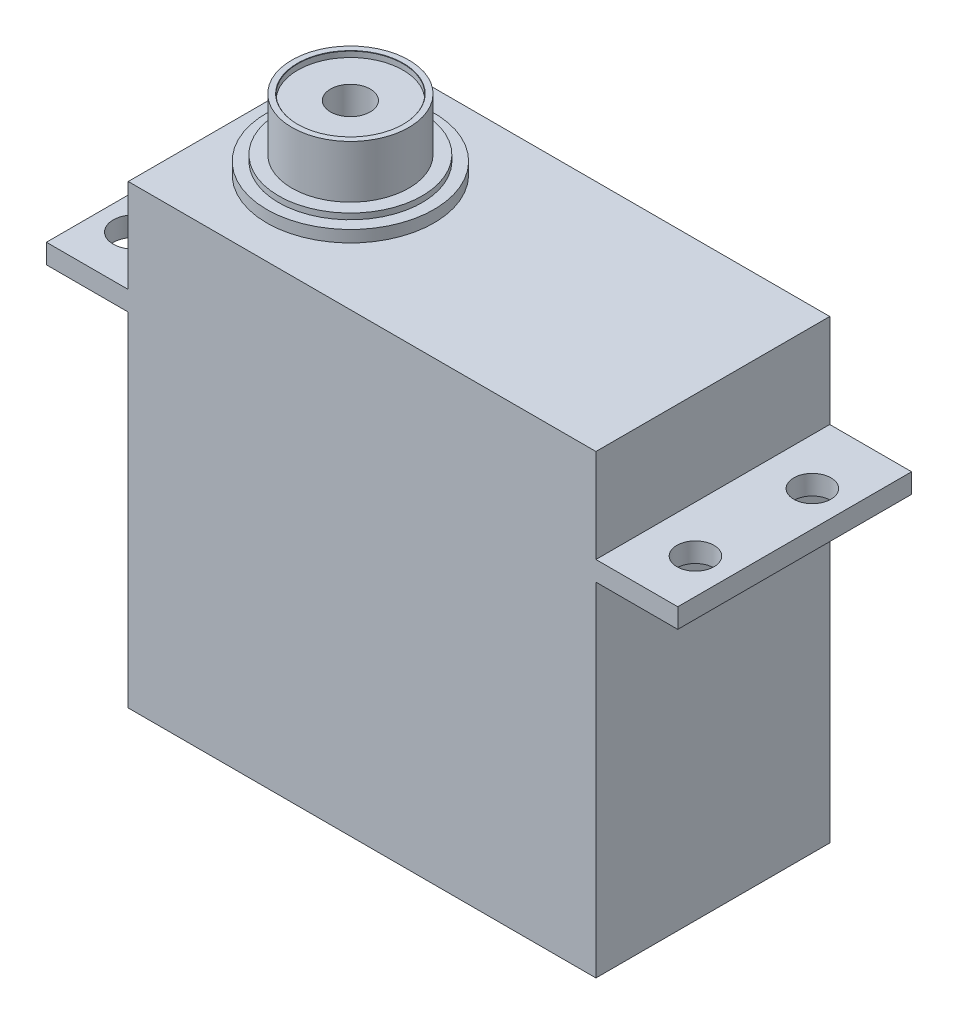
from build123d import *

# Parameters (mm, degrees)
SKETCH_2_W               = 40
SKETCH_2_H               = 20
EXTRUDE_2_DEPTH          = 39
SKETCH_3_W               = 20
SKETCH_3_H               = 1.675329881
EXTRUDE_3_DEPTH          = 7
SKETCH_14_W              = 20
SKETCH_14_H              = 1.675329881
EXTRUDE_4_DEPTH          = 7
CUT_EXTRUDE_3_DEPTH      = 43.308391603
CUT_EXTRUDE_3_DEPTH_BACK = 43.308391603
SKETCH_4_R               = 1.588943236
SKETCH_4_R_2             = 1.799105319
CUT_EXTRUDE_4_DEPTH      = 43.308391603
CUT_EXTRUDE_4_DEPTH_BACK = 43.308391603
SKETCH_15_R              = 1.59
SKETCH_21_R              = 5
EXTRUDE_6_DEPTH          = 6
SKETCH_39_R              = 7.15181499
SKETCH_39_R_2            = 6.138003982
EXTRUDE_9_DEPTH          = 1
SKETCH_40_R              = 6.138003982
SKETCH_40_R_2            = 5
EXTRUDE_10_DEPTH         = 1.5


with BuildPart() as part:
    # 草图2 → 凸台-拉伸2 (new body)
    with BuildSketch(Plane(origin=(0, 0, 0), x_dir=(1, 0, 0), z_dir=(0, 1, 0))):
        Rectangle(SKETCH_2_W, SKETCH_2_H)
    extrude(amount=-EXTRUDE_2_DEPTH)

    # 草图3 → 凸台-拉伸3 (add)
    with BuildSketch(Plane.ZY.offset(20)):
        with Locations((0, -8.837664941)):
            Rectangle(SKETCH_3_W, SKETCH_3_H)
    extrude(amount=EXTRUDE_3_DEPTH)

    # 草图14 → 凸台-拉伸4 (add)
    with BuildSketch(Plane(origin=(20, 0, 0), x_dir=(0, 0, -1), z_dir=(1, 0, 0))):
        with Locations((0, -8.837664941)):
            Rectangle(SKETCH_14_W, SKETCH_14_H)
    extrude(amount=EXTRUDE_4_DEPTH)

    # 草图4 → 切除-拉伸3 (cut, two sides: drawn at the far end of the back side and taken through both)
    with BuildSketch(Plane(origin=(0, -8, 0), x_dir=(1, 0, 0), z_dir=(0, 1, 0)).offset(-CUT_EXTRUDE_3_DEPTH_BACK)):
        with Locations((-24, 4.512341251)):
            Circle(SKETCH_4_R)
        with Locations((-24, -5.487658749)):
            Circle(SKETCH_4_R_2)
    extrude(amount=CUT_EXTRUDE_3_DEPTH + CUT_EXTRUDE_3_DEPTH_BACK, mode=Mode.SUBTRACT)

    # 草图15 → 切除-拉伸4 (cut, two sides: drawn at the far end of the back side and taken through both)
    with BuildSketch(Plane(origin=(0, -8, 0), x_dir=(1, 0, 0), z_dir=(0, 1, 0)).offset(-CUT_EXTRUDE_4_DEPTH_BACK)):
        with Locations((24, 4.512341251)):
            Circle(SKETCH_15_R)
        with Locations((24, -5.487658749)):
            Circle(SKETCH_15_R)
    extrude(amount=CUT_EXTRUDE_4_DEPTH + CUT_EXTRUDE_4_DEPTH_BACK, mode=Mode.SUBTRACT)

    # 草图21 → 凸台-拉伸6 (add)
    with BuildSketch(Plane(origin=(0, 0, 0), x_dir=(1, 0, 0), z_dir=(0, 1, 0))):
        with Locations((-11, 0)):
            Circle(SKETCH_21_R)
    extrude(amount=EXTRUDE_6_DEPTH)

    # 草图39 → 凸台-拉伸9 (add)
    with BuildSketch(Plane(origin=(0, 0, 0), x_dir=(1, 0, 0), z_dir=(0, 1, 0))):
        with Locations((-11, 0)):
            Circle(SKETCH_39_R)
        with Locations((-11, 0)):
            Circle(SKETCH_39_R_2, mode=Mode.SUBTRACT)
    extrude(amount=EXTRUDE_9_DEPTH)

    # 草图40 → 凸台-拉伸10 (add)
    with BuildSketch(Plane(origin=(0, 0, 0), x_dir=(1, 0, 0), z_dir=(0, 1, 0))):
        with Locations((-11, 0)):
            Circle(SKETCH_40_R)
        with Locations((-11, 0)):
            Circle(SKETCH_40_R_2, mode=Mode.SUBTRACT)
    extrude(amount=EXTRUDE_10_DEPTH)

    # 草图47 → M3 六角头螺栓的柱形沉头孔6 (revolve, cut)
    with BuildSketch(Plane(origin=(-11, 6, 0), x_dir=(0, 0, 1), z_dir=(1, 0, 0))):
        Polygon((0, 0), (0, 7.021463052), (1.7, 6), (1.7, 0.5), (4.5, 0.5), (4.5, 0.025), (4.525, 0), align=None)
    revolve(axis=Axis((-11, 12.35, 0), (0, -1, 0)), mode=Mode.SUBTRACT)


solid = part.part
